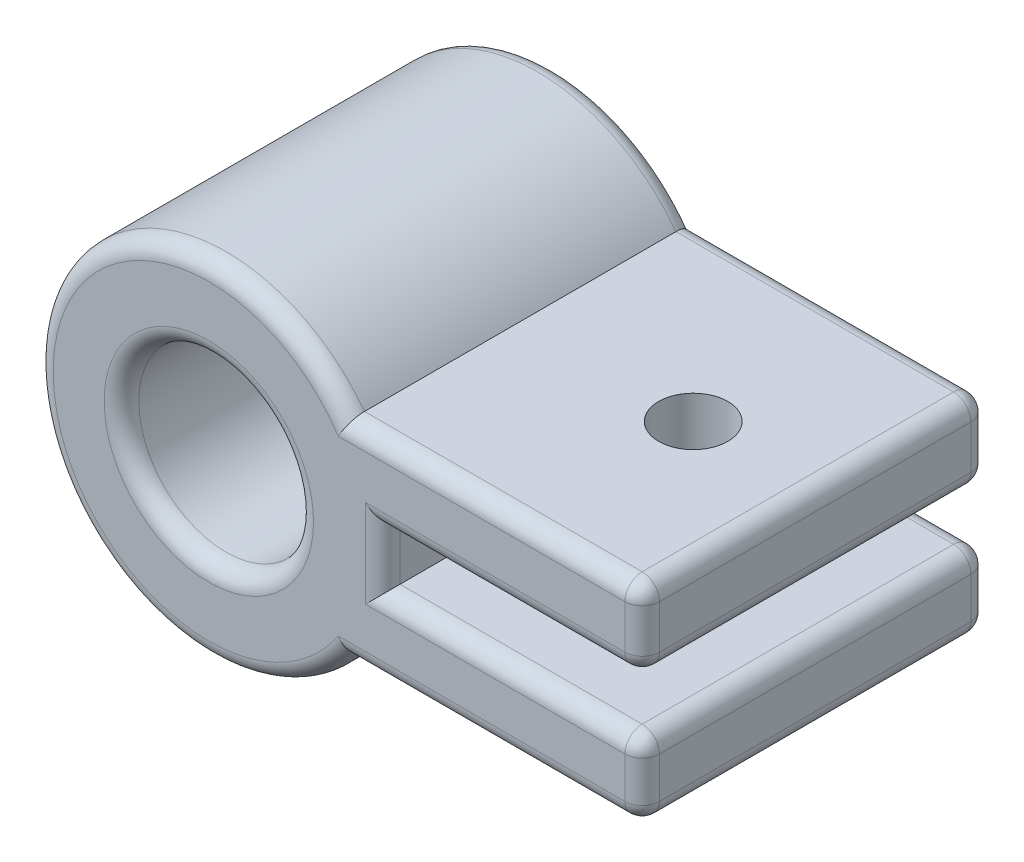
from build123d import *

# Parameters (mm, degrees)
SKETCH_1_R           = 10
SKETCH_1_R_2         = 5.05
EXTRUDE_1_DEPTH      = 20
EXTRUDE_2_DEPTH      = 6
EXTRUDE_2_DEPTH_BACK = 6
SKETCH_2_W           = 20
SKETCH_2_H           = 20
SKETCH_2_R           = 2
SKETCH_3_W           = 20
SKETCH_3_H           = 3.1
CUT_EXTRUDE_1_DEPTH  = 15
FILLET_1_R           = 1


with BuildPart() as part:
    # 草图1 → 凸台-拉伸1 (new body)
    with BuildSketch(Plane.XY):
        Circle(SKETCH_1_R)
        Circle(SKETCH_1_R_2, mode=Mode.SUBTRACT)
    extrude(amount=EXTRUDE_1_DEPTH)

    # 草图2 → 凸台-拉伸2 (add, two sides: drawn at the far end of the back side and taken through both)
    with BuildSketch(Plane(origin=(0, 0, 0), x_dir=(1, 0, 0), z_dir=(0, 1, 0)).offset(-EXTRUDE_2_DEPTH_BACK)):
        with Locations((15.05, -10)):
            Rectangle(SKETCH_2_W, SKETCH_2_H)
        with Locations((18, -10)):
            Circle(SKETCH_2_R, mode=Mode.SUBTRACT)
    extrude(amount=EXTRUDE_2_DEPTH + EXTRUDE_2_DEPTH_BACK)

    # 草图3 → 切除-拉伸1 (cut)
    with BuildSketch(Plane(origin=(25.05, 0, 0), x_dir=(0, 0, -1), z_dir=(1, 0, 0))):
        with Locations((-10, -0.077105761)):
            Rectangle(SKETCH_3_W, SKETCH_3_H)
    extrude(amount=-CUT_EXTRUDE_1_DEPTH, mode=Mode.SUBTRACT)

    # 圆角1
    fillet_1_edges = [part.edges().sort_by_distance(p)[0] for p in [
        (25.05, -6, 10),
        (25.05, -1.627105761, 10),
        (25.05, 6, 10),
        (25.05, 1.472894239, 10),
        (-5.05, 0, 0),
        (16.525, 6, 0),
        (-10, 0, 0),
        (16.525, -6, 0),
        (25.05, -3.81355288, 0),
        (17.55, -1.627105761, 0),
        (10.05, -0.077105761, 0),
        (17.55, 1.472894239, 0),
        (25.05, 3.73644712, 0),
        (-5.05, 0, 20),
        (10.05, -0.077105761, 20),
        (17.55, -1.627105761, 20),
        (25.05, -3.81355288, 20),
        (16.525, -6, 20),
        (-10, 0, 20),
        (16.525, 6, 20),
        (25.05, 3.73644712, 20),
        (17.55, 1.472894239, 20),
    ]]
    fillet(fillet_1_edges, radius=FILLET_1_R)


solid = part.part
